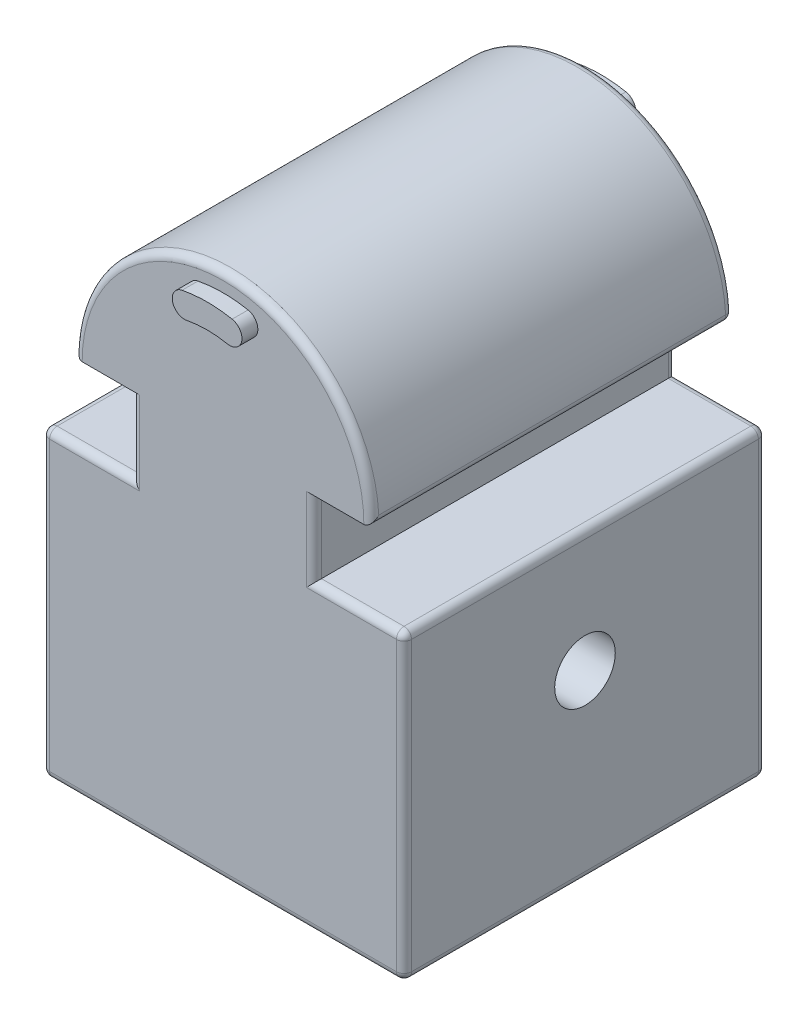
from build123d import *

# Parameters (mm, degrees)
MAIN_BODY_EXTRUDE_DEPTH   = 15.1765
SLOT_EXTRUDE_DEPTH        = 16.51
SKETCH2_W                 = 19.05
SKETCH2_H                 = 19.05
FOOT_CONNECTION_CUT_DEPTH = 22.86
PINHOLE_CUT_DEPTH         = 25.4
FILLET1_R                 = 0.635
CHAMFER2_SIZE             = 2.54
CHAMFER1_SIZE             = 2.54


with BuildPart() as part:
    # Sketch1 → Main Body Extrude (new, symmetric)
    with BuildSketch(Plane.XY):
        with BuildLine():
            ThreePointArc((12.446, 0), (0, 12.446), (-12.446, 0))
            Line((-12.446, 0), (-7.62, 0))
            Line((-7.62, 0), (-7.62, -6.35))
            Line((-7.62, -6.35), (-15.1765, -6.35))
            Line((-15.1765, -6.35), (-15.1765, -31.75))
            Line((-15.1765, -31.75), (15.1765, -31.75))
            Line((15.1765, -31.75), (15.1765, -6.35))
            Line((15.1765, -6.35), (7.62, -6.35))
            Line((7.62, -6.35), (7.62, 0))
            Line((7.62, 0), (12.446, 0))
        make_face()
        with BuildLine():
            ThreePointArc((2.100384615, 10.71813736), (2.902036033, 9.525716711), (1.709615385, 8.724065293))
            ThreePointArc((1.709615385, 8.724065293), (0, 8.89), (-1.709615385, 8.724065293))
            ThreePointArc((-1.709615385, 8.724065293), (-2.902036033, 9.525716711), (-2.100384615, 10.71813736))
            ThreePointArc((-2.100384615, 10.71813736), (0, 10.922), (2.100384615, 10.71813736))
        make_face(mode=Mode.SUBTRACT)
    extrude(amount=MAIN_BODY_EXTRUDE_DEPTH, both=True)

    # Sketch1<4> → Slot Extrude (add, symmetric)
    with BuildSketch(Plane.XY):
        with BuildLine():
            ThreePointArc((-2.100384615, 10.71813736), (-2.902036033, 9.525716711), (-1.709615385, 8.724065293))
            ThreePointArc((-1.709615385, 8.724065293), (0, 8.89), (1.709615385, 8.724065293))
            ThreePointArc((1.709615385, 8.724065293), (2.902036033, 9.525716711), (2.100384615, 10.71813736))
            ThreePointArc((2.100384615, 10.71813736), (0, 10.922), (-2.100384615, 10.71813736))
        make_face()
    extrude(amount=SLOT_EXTRUDE_DEPTH, both=True)

    # Sketch2 → Foot Connection Cut (cut)
    with BuildSketch(Plane.XZ.offset(31.75)):
        Rectangle(SKETCH2_W, SKETCH2_H)
    extrude(amount=-FOOT_CONNECTION_CUT_DEPTH, mode=Mode.SUBTRACT)

    # Sketch4 → Pinhole Cut (cut, symmetric)
    with BuildSketch(Plane(origin=(-9.525, 0, 0), x_dir=(0, 0, -1), z_dir=(1, 0, 0))):
        with BuildLine():
            ThreePointArc((2.54, -16.51), (1.796051224, -14.713948776), (0, -13.97))
            ThreePointArc((0, -13.97), (-1.796051224, -18.306051224), (2.54, -16.51))
        make_face()
    extrude(amount=PINHOLE_CUT_DEPTH, both=True, mode=Mode.SUBTRACT)

    # Fillet1
    fillet1_edges = [part.edges().sort_by_distance(p)[0] for p in [
        (11.39825, -6.35, 15.1765),
        (12.446, 0, 0),
        (15.1765, -6.35, 0),
        (7.62, -3.175, 15.1765),
        (-11.39825, -6.35, 15.1765),
        (-15.1765, -6.35, 0),
        (-7.62, -3.175, 15.1765),
        (-12.446, 0, 0),
        (0, 12.446, 15.1765),
        (11.39825, -6.35, -15.1765),
        (7.62, -3.175, -15.1765),
        (10.033, 0, -15.1765),
        (-10.033, 0, -15.1765),
        (-7.62, -3.175, -15.1765),
        (-11.39825, -6.35, -15.1765),
        (0, 12.446, -15.1765),
        (15.1765, -31.75, 0),
        (-15.1765, -31.75, 0),
        (0, -31.75, 15.1765),
        (0, -31.75, -15.1765),
        (-15.1765, -19.05, -15.1765),
        (-15.1765, -19.05, 15.1765),
        (15.1765, -19.05, 15.1765),
        (15.1765, -19.05, -15.1765),
    ]]
    fillet(fillet1_edges, radius=FILLET1_R)

    # Chamfer2
    chamfer2_edges = [part.edges().sort_by_distance(p)[0] for p in [
        (-9.525, -20.32, -9.525),
        (-9.525, -20.32, 9.525),
        (9.525, -20.32, -9.525),
        (9.525, -20.32, 9.525),
    ]]
    chamfer(chamfer2_edges, length=CHAMFER2_SIZE)

    # Chamfer1
    chamfer1_edges = [part.edges().sort_by_distance(p)[0] for p in [
        (9.525, -31.75, 0),
        (0, -31.75, -9.525),
        (0, -31.75, 9.525),
        (-9.525, -31.75, 0),
        (-8.255, -31.75, 8.255),
        (8.255, -31.75, 8.255),
        (8.255, -31.75, -8.255),
        (-8.255, -31.75, -8.255),
    ]]
    chamfer(chamfer1_edges, length=CHAMFER1_SIZE)


solid = part.part
